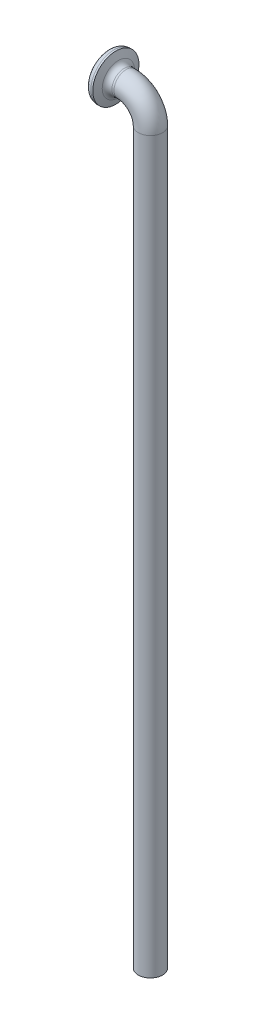
from build123d import *

# Parameters (mm, degrees)
SWEEP1_PROFILE_R    = 1
SKETCH10_R          = 1.9
BOSS_EXTRUDE1_DEPTH = 1.2
CHAMFER1_SIZE       = 1.5
CHAMFER1_SIZE_2     = 0.545955351
FILLET1_R           = 0.5


with BuildPart() as part:
    # Sweep1: sweep along a path in Sketch1
    with BuildLine(Plane.XY) as sweep1_path:
        Line((0, 0), (0, 60))
        ThreePointArc((0, 60), (-0.585786438, 61.414213562), (-2, 62))
        Line((-2, 62), (-3.5, 62))
    # Sweep1 profile (on start of the path) → Sweep1 (sweep)
    with BuildSketch(Plane.ZX):
        Circle(SWEEP1_PROFILE_R)
    sweep(path=sweep1_path.line)

    # Sketch10 → Boss-Extrude1 (add)
    with BuildSketch(Plane.ZY.offset(3.5)):
        with Locations(Location((0, 62, 0), (0, 0, 270))):
            Circle(SKETCH10_R)
    extrude(amount=-BOSS_EXTRUDE1_DEPTH)

    # Chamfer1
    # the kernel refuses this chamfer: 1.5, 0.545955351 mm, written as the material it takes off along each edge
    with BuildSketch(Plane(origin=(-2.3, 62, 0), x_dir=(0, -1, 0), z_dir=(0, 0, -1))) as chamfer1_piece_1_section:
        Polygon((1.9 - CHAMFER1_SIZE, 0), (1.9, CHAMFER1_SIZE_2), (1.9, 0), align=None)
    chamfer1_piece_1 = revolve(axis=Axis((-2.3, 62, 0), (-1, 0, 0)), mode=Mode.PRIVATE)
    chamfer1_piece_1 = chamfer1_piece_1 - Plane(origin=(-2.677798348, 62, 0), x_dir=(0, 0, 1), z_dir=(-1, 0, 0)) * Cylinder(1, 8, mode=Mode.PRIVATE)
    add(chamfer1_piece_1, mode=Mode.SUBTRACT)

    # Fillet1
    fillet1_edges = [part.edges().sort_by_distance(p)[0] for p in [
        (-3.5, 63.9, 0),
        (-2.51838214, 61.292893219, 0.707106781),
    ]]
    fillet(fillet1_edges, radius=FILLET1_R)


solid = part.part
